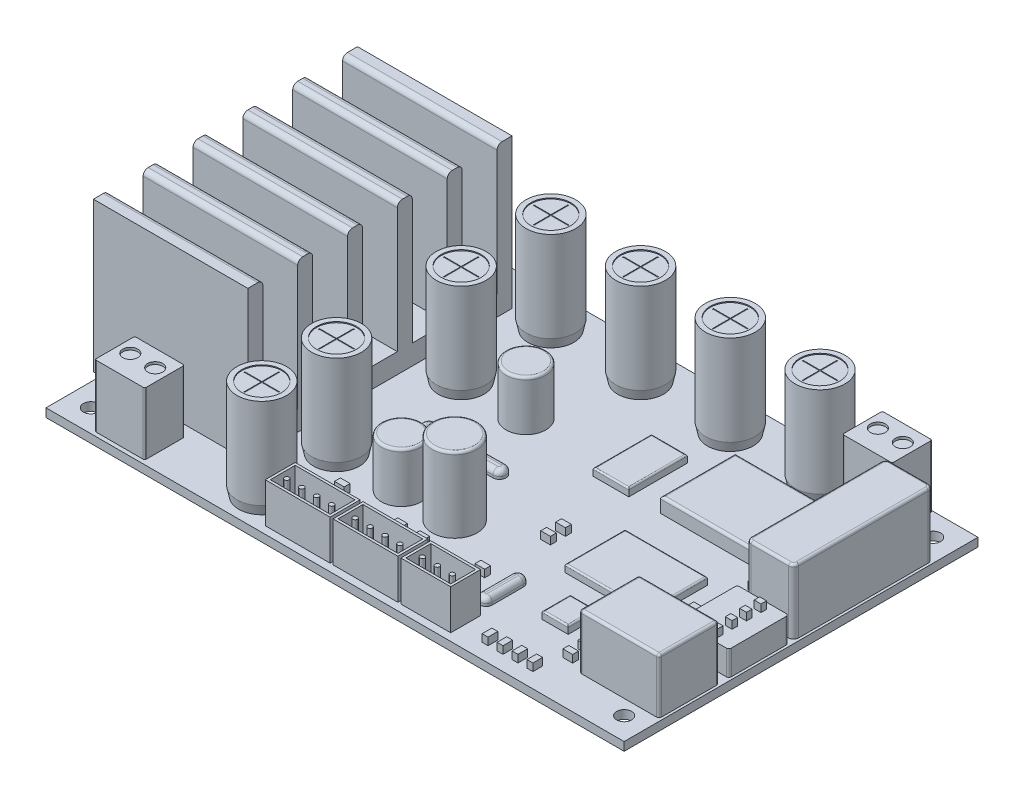
from build123d import *

# Parameters (mm, degrees)
SKETCH1_W               = 116
SKETCH1_H               = 71
SKETCH1_R               = 1.5
BOSS_EXTRUDE1_DEPTH     = 1.7
SKETCH2_R               = 5
BOSS_EXTRUDE2_DEPTH     = 20
SKETCH3_R               = 4
CUT_EXTRUDE1_DEPTH      = 0.2
SKETCH4_W               = 0.2
SKETCH4_H               = 3.4
SKETCH4_W_2             = 3.4
SKETCH4_H_2             = 0.2
CUT_EXTRUDE2_DEPTH      = 0.1
SKETCH5_R               = 5.6
SKETCH5_R_2             = 4.6
CUT_EXTRUDE_THIN1_DEPTH = 2
CUT_EXTRUDE_THIN1_DRAFT = 12
LPATTERN1_START         = 3.581851944
LPATTERN1_OUTLINE_R     = 5
LPATTERN1_DEPTH         = 17.818148056
LPATTERN1_START_2       = 1.7
LPATTERN1_2_OUTLINE_R   = 4
LPATTERN1_2_DEPTH       = 19.7
LPATTERN1_START_3       = 21.4
LPATTERN1_3_OUTLINE_R   = 5
LPATTERN1_3_OUTLINE_R_2 = 4
LPATTERN1_3_DEPTH       = 0.3
LPATTERN1_4_OUTLINE_R   = 4
LPATTERN1_4_DEPTH       = 0.1
BOSS_EXTRUDE3_DEPTH     = 12.5
SKETCH7_R               = 1.5
CUT_EXTRUDE3_DEPTH      = 0.5
LPATTERN2_COUNT         = 2
LPATTERN2_PITCH         = 88
LPATTERN2_COUNT_DIR2    = 2
LPATTERN2_PITCH_DIR2    = 62
SKETCH8_W               = 15
SKETCH8_H               = 35
BOSS_EXTRUDE4_DEPTH     = 2
SKETCH9_W               = 31
SKETCH9_H               = 53
BOSS_EXTRUDE5_DEPTH     = 30
CUT_EXTRUDE5_DEPTH      = 31
SKETCH11_R              = 4
BOSS_EXTRUDE6_DEPTH     = 10
FILLET1_R               = 0.5
SKETCH12_R              = 4.5
BOSS_EXTRUDE7_DEPTH     = 15
FILLET2_R               = 0.5
SKETCH13_W              = 13
SKETCH13_H              = 6
SKETCH13_W_2            = 10
BOSS_EXTRUDE8_DEPTH     = 8
SKETCH14_W              = 12
SKETCH14_H              = 5
SKETCH14_R              = 0.459808867
SKETCH14_W_2            = 9
CUT_EXTRUDE6_DEPTH      = 6
BOSS_EXTRUDE9_DEPTH     = 13
FILLET3_R               = 0.5
BOSS_EXTRUDE10_DEPTH    = 5
SKETCH17_W              = 1.363659291
SKETCH17_H              = 1.107973174
BOSS_EXTRUDE11_DEPTH    = 1.5
BOSS_EXTRUDE12_DEPTH    = 11
FILLET4_R               = 0.5
SKETCH19_W              = 20
SKETCH19_H              = 15
SKETCH19_W_2            = 3
SKETCH19_H_2            = 2
BOSS_EXTRUDE13_DEPTH    = 3
FILLET5_R               = 0.5
SKETCH20_W              = 7.169338187
SKETCH20_H              = 11.731644306
SKETCH20_W_2            = 16.511203098
SKETCH20_H_2            = 12.070508149
SKETCH20_W_3            = 5.214064136
SKETCH20_H_3            = 5.648569481
SKETCH20_W_4            = 1.946575624
SKETCH20_H_4            = 1.189529037
SKETCH20_W_5            = 1.189529037
SKETCH20_H_5            = 1.946575624
BOSS_EXTRUDE14_DEPTH    = 1.5
FILLET6_R               = 1
FILLET7_R               = 0.3


with BuildPart() as part:
    # Sketch1 → Boss-Extrude1 (new body)
    with BuildSketch(Plane(origin=(0, 0, 0), x_dir=(1, 0, 0), z_dir=(0, 1, 0))):
        Rectangle(SKETCH1_W, SKETCH1_H)
        with Locations(Location((53.5, 31, 0), (0, 0, 270))):
            Circle(SKETCH1_R, mode=Mode.SUBTRACT)
        with Locations(Location((-53.5, 31, 0), (0, 0, 90))):
            Circle(SKETCH1_R, mode=Mode.SUBTRACT)
        with Locations(Location((53.5, -31, 0), (0, 0, 90))):
            Circle(SKETCH1_R, mode=Mode.SUBTRACT)
        with Locations(Location((-53.5, -31, 0), (0, 0, 270))):
            Circle(SKETCH1_R, mode=Mode.SUBTRACT)
    extrude(amount=BOSS_EXTRUDE1_DEPTH)

    # Sketch2 → Boss-Extrude2 (add)
    with BuildSketch(Plane(origin=(0, 1.7, 0), x_dir=(1, 0, 0), z_dir=(0, 1, 0))):
        with Locations(Location((33, 28.8, 0), (0, 0, 90))):
            Circle(SKETCH2_R)
    extrude(amount=BOSS_EXTRUDE2_DEPTH)

    # Sketch3 → Cut-Extrude1 (cut)
    with BuildSketch(Plane(origin=(0, 21.7, 0), x_dir=(1, 0, 0), z_dir=(0, 1, 0))):
        with Locations(Location((33, 28.8, 0), (0, 0, 270))):
            Circle(SKETCH3_R)
    extrude(amount=-CUT_EXTRUDE1_DEPTH, mode=Mode.SUBTRACT)

    # Sketch4 → Cut-Extrude2 (cut)
    with BuildSketch(Plane(origin=(0, 21.5, 0), x_dir=(1, 0, 0), z_dir=(0, 1, 0))):
        with Locations((33, 30.6)):
            Rectangle(SKETCH4_W, SKETCH4_H)
        with Locations((34.8, 28.8)):
            Rectangle(SKETCH4_W_2, SKETCH4_H_2)
        with Locations((33, 28.8)):
            Rectangle(SKETCH4_W, SKETCH4_H_2)
        with Locations((31.2, 28.8)):
            Rectangle(SKETCH4_W_2, SKETCH4_H_2)
        with Locations((33, 27)):
            Rectangle(SKETCH4_W, SKETCH4_H)
    extrude(amount=-CUT_EXTRUDE2_DEPTH, mode=Mode.SUBTRACT)


with BuildPart() as cut_extrude_thin1_tool:
    # Sketch5 → Cut-Extrude-Thin1 (with draft: the straight prism first)
    with BuildSketch(Plane(origin=(0, 1.7, 0), x_dir=(1, 0, 0), z_dir=(0, 1, 0))):
        with Locations((33, 28.8)):
            Circle(SKETCH5_R)
        with Locations((33, 28.8)):
            Circle(SKETCH5_R_2, mode=Mode.SUBTRACT)
    extrude(amount=CUT_EXTRUDE_THIN1_DEPTH)
    # Cut-Extrude-Thin1: the draft: its side faces are tilted about the plane it starts from
    cut_extrude_thin1_sides = [cut_extrude_thin1_tool.faces().sort_by_distance(p)[0] for p in [
        (27.4, 2.7, -28.8),
        (28.4, 2.7, -28.8),
    ]]
    draft(cut_extrude_thin1_sides, Plane(origin=(0, 1.7, 0), x_dir=(1, 0, 0), z_dir=(0, 1, 0)), CUT_EXTRUDE_THIN1_DRAFT)


with BuildPart() as part_1:
    add(part.part)

    # Cut-Extrude-Thin1: cut by cut_extrude_thin1_tool
    add(cut_extrude_thin1_tool.part, mode=Mode.SUBTRACT)



with BuildPart() as body_2:
    # LPattern1: read off the stored shape, not the designer's step
    # LPattern1 outline → LPattern1 (new body)
    with BuildSketch(Plane(origin=(0, 0, 0), x_dir=(1, 0, 0), z_dir=(0, 1, 0)).offset(LPATTERN1_START)):
        with Locations((15, 28.8)):
            Circle(LPATTERN1_OUTLINE_R)
        with Locations((-21, 28.8)):
            Circle(LPATTERN1_OUTLINE_R)
        with Locations((-3, 28.8)):
            Circle(LPATTERN1_OUTLINE_R)
        with Locations((-21, -29.2)):
            Circle(LPATTERN1_OUTLINE_R)
        with Locations((-21, -14.2)):
            Circle(LPATTERN1_OUTLINE_R)
        with Locations((-21, 10.8)):
            Circle(LPATTERN1_OUTLINE_R)
    extrude(amount=LPATTERN1_DEPTH)


with BuildPart() as part_2:
    add(part_1.part)

    add(body_2.part)  # LPattern1 2 merges body 2
    # LPattern1 2 outline → LPattern1 2 (add)
    with BuildSketch(Plane(origin=(0, 0, 0), x_dir=(1, 0, 0), z_dir=(0, 1, 0)).offset(LPATTERN1_START_2)):
        with Locations((15, 28.8)):
            Circle(LPATTERN1_2_OUTLINE_R)
        with Locations((-21, 28.8)):
            Circle(LPATTERN1_2_OUTLINE_R)
        with Locations((-3, 28.8)):
            Circle(LPATTERN1_2_OUTLINE_R)
        with Locations((-21, -29.2)):
            Circle(LPATTERN1_2_OUTLINE_R)
        with Locations((-21, -14.2)):
            Circle(LPATTERN1_2_OUTLINE_R)
        with Locations((-21, 10.8)):
            Circle(LPATTERN1_2_OUTLINE_R)
    extrude(amount=LPATTERN1_2_DEPTH)

    # LPattern1 3 outline → LPattern1 3 (add)
    # profile 1 of 6: a face of its own
    with BuildSketch(Plane(origin=(0, 0, 0), x_dir=(1, 0, 0), z_dir=(0, 1, 0)).offset(LPATTERN1_START_3)):
        with Locations((15, 28.8)):
            Circle(LPATTERN1_3_OUTLINE_R)
        with Locations((15, 28.8)):
            Circle(LPATTERN1_3_OUTLINE_R_2, mode=Mode.SUBTRACT)
    # profile 2 of 6: a face of its own
    with BuildSketch(Plane(origin=(0, 0, 0), x_dir=(1, 0, 0), z_dir=(0, 1, 0)).offset(LPATTERN1_START_3)):
        with Locations((-21, -29.2)):
            Circle(LPATTERN1_3_OUTLINE_R)
        with Locations((-21, -29.2)):
            Circle(LPATTERN1_3_OUTLINE_R_2, mode=Mode.SUBTRACT)
    # profile 3 of 6: a face of its own
    with BuildSketch(Plane(origin=(0, 0, 0), x_dir=(1, 0, 0), z_dir=(0, 1, 0)).offset(LPATTERN1_START_3)):
        with Locations((-21, -14.2)):
            Circle(LPATTERN1_3_OUTLINE_R)
        with Locations((-21, -14.2)):
            Circle(LPATTERN1_3_OUTLINE_R_2, mode=Mode.SUBTRACT)
    # profile 4 of 6: a face of its own
    with BuildSketch(Plane(origin=(0, 0, 0), x_dir=(1, 0, 0), z_dir=(0, 1, 0)).offset(LPATTERN1_START_3)):
        with Locations((-21, 10.8)):
            Circle(LPATTERN1_3_OUTLINE_R)
        with Locations((-21, 10.8)):
            Circle(LPATTERN1_3_OUTLINE_R_2, mode=Mode.SUBTRACT)
    # profile 5 of 6: a face of its own
    with BuildSketch(Plane(origin=(0, 0, 0), x_dir=(1, 0, 0), z_dir=(0, 1, 0)).offset(LPATTERN1_START_3)):
        with Locations((-21, 28.8)):
            Circle(LPATTERN1_3_OUTLINE_R)
        with Locations((-21, 28.8)):
            Circle(LPATTERN1_3_OUTLINE_R_2, mode=Mode.SUBTRACT)
    # profile 6 of 6: a face of its own
    with BuildSketch(Plane(origin=(0, 0, 0), x_dir=(1, 0, 0), z_dir=(0, 1, 0)).offset(LPATTERN1_START_3)):
        with Locations((-3, 28.8)):
            Circle(LPATTERN1_3_OUTLINE_R)
        with Locations((-3, 28.8)):
            Circle(LPATTERN1_3_OUTLINE_R_2, mode=Mode.SUBTRACT)
    extrude(amount=LPATTERN1_3_DEPTH)

    # LPattern1 4 outline → LPattern1 4 (add)
    # profile 1 of 6: a face of its own
    with BuildSketch(Plane(origin=(0, 0, 0), x_dir=(1, 0, 0), z_dir=(0, 1, 0)).offset(LPATTERN1_START_3)):
        with Locations((15, 28.8)):
            Circle(LPATTERN1_4_OUTLINE_R)
        Polygon((14.9, 28.9), (14.9, 32.3), (15.1, 32.3), (15.1, 28.9), (18.5, 28.9), (18.5, 28.7), (15.1, 28.7), (15.1, 25.3), (14.9, 25.3), (14.9, 28.7), (11.5, 28.7), (11.5, 28.9), align=None, mode=Mode.SUBTRACT)
    # profile 2 of 6: a face of its own
    with BuildSketch(Plane(origin=(0, 0, 0), x_dir=(1, 0, 0), z_dir=(0, 1, 0)).offset(LPATTERN1_START_3)):
        with Locations((-21, -29.2)):
            Circle(LPATTERN1_4_OUTLINE_R)
        Polygon((-21.1, -29.3), (-24.5, -29.3), (-24.5, -29.1), (-21.1, -29.1), (-21.1, -25.7), (-20.9, -25.7), (-20.9, -29.1), (-17.5, -29.1), (-17.5, -29.3), (-20.9, -29.3), (-20.9, -32.7), (-21.1, -32.7), align=None, mode=Mode.SUBTRACT)
    # profile 3 of 6: a face of its own
    with BuildSketch(Plane(origin=(0, 0, 0), x_dir=(1, 0, 0), z_dir=(0, 1, 0)).offset(LPATTERN1_START_3)):
        with Locations((-21, -14.2)):
            Circle(LPATTERN1_4_OUTLINE_R)
        Polygon((-21.1, -14.3), (-24.5, -14.3), (-24.5, -14.1), (-21.1, -14.1), (-21.1, -10.7), (-20.9, -10.7), (-20.9, -14.1), (-17.5, -14.1), (-17.5, -14.3), (-20.9, -14.3), (-20.9, -17.7), (-21.1, -17.7), align=None, mode=Mode.SUBTRACT)
    # profile 4 of 6: a face of its own
    with BuildSketch(Plane(origin=(0, 0, 0), x_dir=(1, 0, 0), z_dir=(0, 1, 0)).offset(LPATTERN1_START_3)):
        with Locations((-21, 10.8)):
            Circle(LPATTERN1_4_OUTLINE_R)
        Polygon((-21.1, 10.7), (-24.5, 10.7), (-24.5, 10.9), (-21.1, 10.9), (-21.1, 14.3), (-20.9, 14.3), (-20.9, 10.9), (-17.5, 10.9), (-17.5, 10.7), (-20.9, 10.7), (-20.9, 7.3), (-21.1, 7.3), align=None, mode=Mode.SUBTRACT)
    # profile 5 of 6: a face of its own
    with BuildSketch(Plane(origin=(0, 0, 0), x_dir=(1, 0, 0), z_dir=(0, 1, 0)).offset(LPATTERN1_START_3)):
        with Locations((-21, 28.8)):
            Circle(LPATTERN1_4_OUTLINE_R)
        Polygon((-21.1, 28.9), (-21.1, 32.3), (-20.9, 32.3), (-20.9, 28.9), (-17.5, 28.9), (-17.5, 28.7), (-20.9, 28.7), (-20.9, 25.3), (-21.1, 25.3), (-21.1, 28.7), (-24.5, 28.7), (-24.5, 28.9), align=None, mode=Mode.SUBTRACT)
    # profile 6 of 6: a face of its own
    with BuildSketch(Plane(origin=(0, 0, 0), x_dir=(1, 0, 0), z_dir=(0, 1, 0)).offset(LPATTERN1_START_3)):
        with Locations((-3, 28.8)):
            Circle(LPATTERN1_4_OUTLINE_R)
        Polygon((-3.1, 28.9), (-3.1, 32.3), (-2.9, 32.3), (-2.9, 28.9), (0.5, 28.9), (0.5, 28.7), (-2.9, 28.7), (-2.9, 25.3), (-3.1, 25.3), (-3.1, 28.7), (-6.5, 28.7), (-6.5, 28.9), align=None, mode=Mode.SUBTRACT)
    extrude(amount=LPATTERN1_4_DEPTH)

    # LPattern1 5: loft between two sections, ruled curve by curve
    lpattern1_5_from = [
        Edge.make_three_point_arc((15, 1.7, -24.2), (19.6, 1.7, -28.8), (15, 1.7, -33.4)),
        Edge.make_three_point_arc((15, 1.7, -33.4), (10.4, 1.7, -28.8), (15, 1.7, -24.2)),
    ]
    lpattern1_5_to = [
        Edge.make_three_point_arc((15, 3.581852044, -23.8), (20, 3.581852044, -28.8), (15, 3.581852044, -33.8)),
        Edge.make_three_point_arc((15, 3.581852044, -33.8), (10, 3.581852044, -28.8), (15, 3.581852044, -23.8)),
    ]
    lpattern1_5 = Solid(Shell([*[Face.make_surface_from_curves(lpattern1_5_from[k], lpattern1_5_to[k]) for k in range(2)], Face(Wire(lpattern1_5_from)), Face(Wire(lpattern1_5_to))]))
    add(lpattern1_5)

    # LPattern1 6: loft between two sections, ruled curve by curve
    lpattern1_6_from = [
        Edge.make_three_point_arc((-21, 1.7, 33.8), (-16.4, 1.7, 29.2), (-21, 1.7, 24.6)),
        Edge.make_three_point_arc((-21, 1.7, 24.6), (-25.6, 1.7, 29.2), (-21, 1.7, 33.8)),
    ]
    lpattern1_6_to = [
        Edge.make_three_point_arc((-21, 3.581852044, 34.2), (-16, 3.581852044, 29.2), (-21, 3.581852044, 24.2)),
        Edge.make_three_point_arc((-21, 3.581852044, 24.2), (-26, 3.581852044, 29.2), (-21, 3.581852044, 34.2)),
    ]
    lpattern1_6 = Solid(Shell([*[Face.make_surface_from_curves(lpattern1_6_from[k], lpattern1_6_to[k]) for k in range(2)], Face(Wire(lpattern1_6_from)), Face(Wire(lpattern1_6_to))]))
    add(lpattern1_6)

    # LPattern1 7: loft between two sections, ruled curve by curve
    lpattern1_7_from = [
        Edge.make_three_point_arc((-21, 1.7, 18.8), (-16.4, 1.7, 14.2), (-21, 1.7, 9.6)),
        Edge.make_three_point_arc((-21, 1.7, 9.6), (-25.6, 1.7, 14.2), (-21, 1.7, 18.8)),
    ]
    lpattern1_7_to = [
        Edge.make_three_point_arc((-21, 3.581852044, 19.2), (-16, 3.581852044, 14.2), (-21, 3.581852044, 9.2)),
        Edge.make_three_point_arc((-21, 3.581852044, 9.2), (-26, 3.581852044, 14.2), (-21, 3.581852044, 19.2)),
    ]
    lpattern1_7 = Solid(Shell([*[Face.make_surface_from_curves(lpattern1_7_from[k], lpattern1_7_to[k]) for k in range(2)], Face(Wire(lpattern1_7_from)), Face(Wire(lpattern1_7_to))]))
    add(lpattern1_7)

    # LPattern1 8: loft between two sections, ruled curve by curve
    lpattern1_8_from = [
        Edge.make_three_point_arc((-21, 1.7, -6.2), (-16.4, 1.7, -10.8), (-21, 1.7, -15.4)),
        Edge.make_three_point_arc((-21, 1.7, -15.4), (-25.6, 1.7, -10.8), (-21, 1.7, -6.2)),
    ]
    lpattern1_8_to = [
        Edge.make_three_point_arc((-21, 3.581852044, -5.8), (-16, 3.581852044, -10.8), (-21, 3.581852044, -15.8)),
        Edge.make_three_point_arc((-21, 3.581852044, -15.8), (-26, 3.581852044, -10.8), (-21, 3.581852044, -5.8)),
    ]
    lpattern1_8 = Solid(Shell([*[Face.make_surface_from_curves(lpattern1_8_from[k], lpattern1_8_to[k]) for k in range(2)], Face(Wire(lpattern1_8_from)), Face(Wire(lpattern1_8_to))]))
    add(lpattern1_8)

    # LPattern1 9: loft between two sections, ruled curve by curve
    lpattern1_9_from = [
        Edge.make_three_point_arc((-21, 1.7, -24.2), (-16.4, 1.7, -28.8), (-21, 1.7, -33.4)),
        Edge.make_three_point_arc((-21, 1.7, -33.4), (-25.6, 1.7, -28.8), (-21, 1.7, -24.2)),
    ]
    lpattern1_9_to = [
        Edge.make_three_point_arc((-21, 3.581852044, -23.8), (-16, 3.581852044, -28.8), (-21, 3.581852044, -33.8)),
        Edge.make_three_point_arc((-21, 3.581852044, -33.8), (-26, 3.581852044, -28.8), (-21, 3.581852044, -23.8)),
    ]
    lpattern1_9 = Solid(Shell([*[Face.make_surface_from_curves(lpattern1_9_from[k], lpattern1_9_to[k]) for k in range(2)], Face(Wire(lpattern1_9_from)), Face(Wire(lpattern1_9_to))]))
    add(lpattern1_9)

    # LPattern1 10: loft between two sections, ruled curve by curve
    lpattern1_10_from = [
        Edge.make_three_point_arc((-3, 1.7, -24.2), (1.6, 1.7, -28.8), (-3, 1.7, -33.4)),
        Edge.make_three_point_arc((-3, 1.7, -33.4), (-7.6, 1.7, -28.8), (-3, 1.7, -24.2)),
    ]
    lpattern1_10_to = [
        Edge.make_three_point_arc((-3, 3.581852044, -23.8), (2, 3.581852044, -28.8), (-3, 3.581852044, -33.8)),
        Edge.make_three_point_arc((-3, 3.581852044, -33.8), (-8, 3.581852044, -28.8), (-3, 3.581852044, -23.8)),
    ]
    lpattern1_10 = Solid(Shell([*[Face.make_surface_from_curves(lpattern1_10_from[k], lpattern1_10_to[k]) for k in range(2)], Face(Wire(lpattern1_10_from)), Face(Wire(lpattern1_10_to))]))
    add(lpattern1_10)

    # Sketch6 → Boss-Extrude3 (add)
    with BuildSketch(Plane(origin=(0, 1.7, 0), x_dir=(1, 0, 0), z_dir=(0, 1, 0))):
        with BuildLine():
            Line((39.3, 27.3), (48.7, 27.3))
            ThreePointArc((48.7, 27.3), (48.912132034, 27.387867966), (49, 27.6))
            Line((49, 27.6), (49, 35))
            ThreePointArc((49, 35), (48.912132034, 35.212132034), (48.7, 35.3))
            Line((48.7, 35.3), (39.3, 35.3))
            ThreePointArc((39.3, 35.3), (39.087867966, 35.212132034), (39, 35))
            Line((39, 35), (39, 27.6))
            ThreePointArc((39, 27.6), (39.087867966, 27.387867966), (39.3, 27.3))
        make_face()
    boss_extrude3 = extrude(amount=BOSS_EXTRUDE3_DEPTH)

    # Sketch7 → Cut-Extrude3 (cut)
    with BuildSketch(Plane(origin=(0, 14.2, 0), x_dir=(1, 0, 0), z_dir=(0, 1, 0))):
        with Locations(Location((41.5, 31.913386137, 0), (0, 0, 270))):
            Circle(SKETCH7_R)
        with Locations(Location((46.5, 31.913386137, 0), (0, 0, 270))):
            Circle(SKETCH7_R)
    cut_extrude3 = extrude(amount=-CUT_EXTRUDE3_DEPTH, mode=Mode.SUBTRACT)

    # LPattern2: Boss-Extrude3, Cut-Extrude3 2 × 2, 1 skipped
    with Locations(*[(-i * LPATTERN2_PITCH, 0, j * LPATTERN2_PITCH_DIR2) for i in range(LPATTERN2_COUNT) for j in range(LPATTERN2_COUNT_DIR2) if (i, j) not in ((0, 0), (0, 1))]):
        add(boss_extrude3)
        add(cut_extrude3, mode=Mode.SUBTRACT)

    # Sketch8 → Boss-Extrude4 (add)
    with BuildSketch(Plane(origin=(0, 1.7, 0), x_dir=(1, 0, 0), z_dir=(0, 1, 0))):
        with Locations((-45, 0)):
            Rectangle(SKETCH8_W, SKETCH8_H)
    extrude(amount=BOSS_EXTRUDE4_DEPTH)

    # Sketch9 → Boss-Extrude5 (add)
    with BuildSketch(Plane(origin=(0, 3.7, 0), x_dir=(1, 0, 0), z_dir=(0, 1, 0))):
        with Locations((-42, 0)):
            Rectangle(SKETCH9_W, SKETCH9_H)
    extrude(amount=BOSS_EXTRUDE5_DEPTH)

    # Sketch10 → Cut-Extrude5 (cut)
    with BuildSketch(Plane.ZY.offset(57.5)):
        Polygon((25.5, 33.7), (26.5, 33.7), (26.5, 38.379287755), (-26.5, 38.379287755), (-26.5, 33.7), (-25.5, 33.7), (-24.5, 33.7), (-15.5, 33.7), (-14.5, 33.7), (-5.5, 33.7), (-4.5, 33.7), (4.5, 33.7), (5.5, 33.7), (14.5, 33.7), (15.5, 33.7), (24.5, 33.7), align=None)
        with BuildLine():
            Line((16.5, 7.7), (23.5, 7.7))
            Line((23.5, 7.7), (23.5, 32.7))
            ThreePointArc((23.5, 32.7), (23.792893219, 33.407106781), (24.5, 33.7))
            Line((24.5, 33.7), (15.5, 33.7))
            ThreePointArc((15.5, 33.7), (16.207106781, 33.407106781), (16.5, 32.7))
            Line((16.5, 32.7), (16.5, 7.7))
        make_face()
        with BuildLine():
            Line((6.5, 7.7), (13.5, 7.7))
            Line((13.5, 7.7), (13.5, 32.7))
            ThreePointArc((13.5, 32.7), (13.792893219, 33.407106781), (14.5, 33.7))
            Line((14.5, 33.7), (5.5, 33.7))
            ThreePointArc((5.5, 33.7), (6.207106781, 33.407106781), (6.5, 32.7))
            Line((6.5, 32.7), (6.5, 7.7))
        make_face()
        with BuildLine():
            Line((-3.5, 7.7), (3.5, 7.7))
            Line((3.5, 7.7), (3.5, 32.7))
            ThreePointArc((3.5, 32.7), (3.792893219, 33.407106781), (4.5, 33.7))
            Line((4.5, 33.7), (-4.5, 33.7))
            ThreePointArc((-4.5, 33.7), (-3.792893219, 33.407106781), (-3.5, 32.7))
            Line((-3.5, 32.7), (-3.5, 7.7))
        make_face()
        with BuildLine():
            Line((-13.5, 7.7), (-6.5, 7.7))
            Line((-6.5, 7.7), (-6.5, 32.7))
            ThreePointArc((-6.5, 32.7), (-6.207106781, 33.407106781), (-5.5, 33.7))
            Line((-5.5, 33.7), (-14.5, 33.7))
            ThreePointArc((-14.5, 33.7), (-13.792893219, 33.407106781), (-13.5, 32.7))
            Line((-13.5, 32.7), (-13.5, 7.7))
        make_face()
        with BuildLine():
            Line((-15.5, 33.7), (-24.5, 33.7))
            ThreePointArc((-24.5, 33.7), (-23.792893219, 33.407106781), (-23.5, 32.7))
            Line((-23.5, 32.7), (-23.5, 7.7))
            Line((-23.5, 7.7), (-16.5, 7.7))
            Line((-16.5, 7.7), (-16.5, 32.7))
            ThreePointArc((-16.5, 32.7), (-16.207106781, 33.407106781), (-15.5, 33.7))
        make_face()
    extrude(amount=-CUT_EXTRUDE5_DEPTH, mode=Mode.SUBTRACT)

    # Sketch11 → Boss-Extrude6 (add)
    with BuildSketch(Plane(origin=(0, 1.7, 0), x_dir=(1, 0, 0), z_dir=(0, 1, 0))):
        with Locations(Location((-8, 10.8, 0), (0, 0, 90))):
            Circle(SKETCH11_R)
        with Locations(Location((-8, -14.2, 0), (0, 0, 90))):
            Circle(SKETCH11_R)
    extrude(amount=BOSS_EXTRUDE6_DEPTH)

    # Fillet1
    fillet1_edges = [part_2.edges().sort_by_distance(p)[0] for p in [
        (-8, 11.7, -6.8),
        (-8, 11.7, 18.2),
    ]]
    fillet(fillet1_edges, radius=FILLET1_R)

    # Sketch12 → Boss-Extrude7 (add)
    with BuildSketch(Plane(origin=(0, 1.7, 0), x_dir=(1, 0, 0), z_dir=(0, 1, 0))):
        with Locations(Location((2.5, -14, 0), (0, 0, 90))):
            Circle(SKETCH12_R)
    extrude(amount=BOSS_EXTRUDE7_DEPTH)

    # Fillet2
    fillet2_edges = [part_2.edges().sort_by_distance(p)[0] for p in [
        (2.5, 16.7, 18.5),
    ]]
    fillet(fillet2_edges, radius=FILLET2_R)

    # Sketch13 → Boss-Extrude8 (add)
    with BuildSketch(Plane(origin=(0, 1.7, 0), x_dir=(1, 0, 0), z_dir=(0, 1, 0))):
        with Locations((-9, -31)):
            Rectangle(SKETCH13_W, SKETCH13_H)
        with Locations((4.6, -31)):
            Rectangle(SKETCH13_W, SKETCH13_H)
        with Locations((16.7, -31)):
            Rectangle(SKETCH13_W_2, SKETCH13_H)
    extrude(amount=BOSS_EXTRUDE8_DEPTH)

    # Sketch14 → Cut-Extrude6 (cut)
    # profile 1 of 3: a face of its own
    with BuildSketch(Plane(origin=(0, 9.7, 0), x_dir=(1, 0, 0), z_dir=(0, 1, 0))):
        with Locations((-9, -31)):
            Rectangle(SKETCH14_W, SKETCH14_H)
        with Locations(Location((-13.553216535, -31.632143805, 0), (0, 0, 270))):
            Circle(SKETCH14_R, mode=Mode.SUBTRACT)
        with Locations(Location((-10.553216535, -31.632143805, 0), (0, 0, 270))):
            Circle(SKETCH14_R, mode=Mode.SUBTRACT)
        with Locations(Location((-7.553216535, -31.632143805, 0), (0, 0, 270))):
            Circle(SKETCH14_R, mode=Mode.SUBTRACT)
        with Locations(Location((-4.553216535, -31.632143805, 0), (0, 0, 270))):
            Circle(SKETCH14_R, mode=Mode.SUBTRACT)
    # profile 2 of 3: a face of its own
    with BuildSketch(Plane(origin=(0, 9.7, 0), x_dir=(1, 0, 0), z_dir=(0, 1, 0))):
        with Locations((4.6, -31)):
            Rectangle(SKETCH14_W, SKETCH14_H)
        with Locations(Location((0.153216535, -31.632143805, 0), (0, 0, 270))):
            Circle(SKETCH14_R, mode=Mode.SUBTRACT)
        with Locations(Location((3.153216535, -31.632143805, 0), (0, 0, 270))):
            Circle(SKETCH14_R, mode=Mode.SUBTRACT)
        with Locations(Location((6.153216535, -31.632143805, 0), (0, 0, 270))):
            Circle(SKETCH14_R, mode=Mode.SUBTRACT)
        with Locations(Location((9.153216535, -31.632143805, 0), (0, 0, 270))):
            Circle(SKETCH14_R, mode=Mode.SUBTRACT)
    # profile 3 of 3: a face of its own
    with BuildSketch(Plane(origin=(0, 9.7, 0), x_dir=(1, 0, 0), z_dir=(0, 1, 0))):
        with Locations((16.7, -31)):
            Rectangle(SKETCH14_W_2, SKETCH14_H)
        with Locations(Location((13.646783465, -31.632143805, 0), (0, 0, 270))):
            Circle(SKETCH14_R, mode=Mode.SUBTRACT)
        with Locations(Location((16.646783465, -31.632143805, 0), (0, 0, 270))):
            Circle(SKETCH14_R, mode=Mode.SUBTRACT)
        with Locations(Location((19.646783465, -31.632143805, 0), (0, 0, 270))):
            Circle(SKETCH14_R, mode=Mode.SUBTRACT)
    extrude(amount=-CUT_EXTRUDE6_DEPTH, mode=Mode.SUBTRACT)

    # Sketch15 → Boss-Extrude9 (add)
    with BuildSketch(Plane(origin=(0, 1.7, 0), x_dir=(1, 0, 0), z_dir=(0, 1, 0))):
        with BuildLine():
            Line((56.5, 27), (49, 27))
            ThreePointArc((49, 27), (48.292893219, 26.707106781), (48, 26))
            Line((48, 26), (48, 0))
            ThreePointArc((48, 0), (48.292893219, -0.707106781), (49, -1))
            Line((49, -1), (56.5, -1))
            ThreePointArc((56.5, -1), (57.207106781, -0.707106781), (57.5, 0))
            Line((57.5, 0), (57.5, 26))
            ThreePointArc((57.5, 26), (57.207106781, 26.707106781), (56.5, 27))
        make_face()
    extrude(amount=BOSS_EXTRUDE9_DEPTH)

    # Fillet3
    fillet3_edges = [part_2.edges().sort_by_distance(p)[0] for p in [
        (57.207106781, 14.7, -26.707106781),
        (52.75, 14.7, -27),
        (48.292893219, 14.7, -26.707106781),
        (48, 14.7, -13),
        (48.292893219, 14.7, 0.707106781),
        (52.75, 14.7, 1),
        (57.207106781, 14.7, 0.707106781),
        (57.5, 14.7, -13),
    ]]
    fillet(fillet3_edges, radius=FILLET3_R)

    # Sketch16 → Boss-Extrude10 (add)
    with BuildSketch(Plane(origin=(0, 1.7, 0), x_dir=(1, 0, 0), z_dir=(0, 1, 0))):
        with BuildLine():
            Line((47.7, -14), (57, -14))
            ThreePointArc((57, -14), (57.353553391, -13.853553391), (57.5, -13.5))
            Line((57.5, -13.5), (57.5, -2.5))
            ThreePointArc((57.5, -2.5), (57.353553391, -2.146446609), (57, -2))
            Line((57, -2), (47.7, -2))
            ThreePointArc((47.7, -2), (47.346446609, -2.146446609), (47.2, -2.5))
            Line((47.2, -2.5), (47.2, -13.5))
            ThreePointArc((47.2, -13.5), (47.346446609, -13.853553391), (47.7, -14))
        make_face()
    extrude(amount=BOSS_EXTRUDE10_DEPTH)

    # Sketch17 → Boss-Extrude11 (add)
    with BuildSketch(Plane(origin=(0, 6.7, 0), x_dir=(1, 0, 0), z_dir=(0, 1, 0))):
        with Locations((53.632306445, -6.707784089)):
            Rectangle(SKETCH17_W, SKETCH17_H)
        with Locations((53.632306445, -3.807784089)):
            Rectangle(SKETCH17_W, SKETCH17_H)
        with Locations((53.632306445, -9.607784089)):
            Rectangle(SKETCH17_W, SKETCH17_H)
        with Locations((53.632306445, -12.507784089)):
            Rectangle(SKETCH17_W, SKETCH17_H)
    extrude(amount=BOSS_EXTRUDE11_DEPTH)

    # Sketch18 → Boss-Extrude12 (add)
    with BuildSketch(Plane(origin=(0, 1.7, 0), x_dir=(1, 0, 0), z_dir=(0, 1, 0))):
        with BuildLine():
            Line((42, -16), (57, -16))
            ThreePointArc((57, -16), (57.353553391, -16.146446609), (57.5, -16.5))
            Line((57.5, -16.5), (57.5, -27.5))
            ThreePointArc((57.5, -27.5), (57.353553391, -27.853553391), (57, -28))
            Line((57, -28), (42, -28))
            ThreePointArc((42, -28), (41.646446609, -27.853553391), (41.5, -27.5))
            Line((41.5, -27.5), (41.5, -16.5))
            ThreePointArc((41.5, -16.5), (41.646446609, -16.146446609), (42, -16))
        make_face()
    extrude(amount=BOSS_EXTRUDE12_DEPTH)

    # Fillet4
    fillet4_edges = [part_2.edges().sort_by_distance(p)[0] for p in [
        (41.646446609, 12.7, 27.853553391),
        (49.5, 12.7, 28),
        (57.353553391, 12.7, 27.853553391),
        (57.5, 12.7, 22),
        (57.353553391, 12.7, 16.146446609),
        (49.5, 12.7, 16),
        (41.646446609, 12.7, 16.146446609),
        (41.5, 12.7, 22),
    ]]
    fillet(fillet4_edges, radius=FILLET4_R)

    # Sketch19 → Boss-Extrude13 (add)
    with BuildSketch(Plane(origin=(0, 1.7, 0), x_dir=(1, 0, 0), z_dir=(0, 1, 0))):
        with Locations((32, 15.3)):
            Rectangle(SKETCH19_W, SKETCH19_H)
        with Locations((43.5, 18.8)):
            Rectangle(SKETCH19_W_2, SKETCH19_H_2)
        with Locations((43.5, 14.8)):
            Rectangle(SKETCH19_W_2, SKETCH19_H_2)
        with Locations((43.5, 10.8)):
            Rectangle(SKETCH19_W_2, SKETCH19_H_2)
    extrude(amount=BOSS_EXTRUDE13_DEPTH)

    # Fillet5
    fillet5_edges = [part_2.edges().sort_by_distance(p)[0] for p in [
        (45, 4.7, -10.8),
        (43.5, 4.7, -11.8),
        (45, 4.7, -14.8),
        (43.5, 4.7, -15.8),
        (45, 4.7, -18.8),
        (43.5, 4.7, -19.8),
        (32, 4.7, -22.8),
        (22, 4.7, -15.3),
        (32, 4.7, -7.8),
        (42, 4.7, -8.8),
        (43.5, 4.7, -9.8),
        (42, 4.7, -12.8),
        (43.5, 4.7, -13.8),
        (42, 4.7, -16.8),
        (43.5, 4.7, -17.8),
        (42, 4.7, -21.3),
    ]]
    fillet(fillet5_edges, radius=FILLET5_R)

    # Sketch20 → Boss-Extrude14 (add)
    with BuildSketch(Plane(origin=(0, 1.7, 0), x_dir=(1, 0, 0), z_dir=(0, 1, 0))):
        with Locations((12.369238112, 13.348054515)):
            Rectangle(SKETCH20_W, SKETCH20_H)
        with Locations((30.944341598, -6.035254075)):
            Rectangle(SKETCH20_W_2, SKETCH20_H_2)
        with Locations((31.16159427, -19.674351681)):
            Rectangle(SKETCH20_W_3, SKETCH20_H_3)
        with BuildLine():
            Line((18.640363835, -25.030085692), (18.640363835, -18.764608793))
            ThreePointArc((18.640363835, -18.764608793), (19.842645549, -17.562327079), (21.044927263, -18.764608793))
            Line((21.044927263, -18.764608793), (21.044927263, -25.030085692))
            ThreePointArc((21.044927263, -25.030085692), (19.842645549, -26.232367406), (18.640363835, -25.030085692))
        make_face()
        with Locations((38.226655335, -20.44483146)):
            Rectangle(SKETCH20_W_4, SKETCH20_H_4)
        with Locations((38.226655335, -17.44483146)):
            Rectangle(SKETCH20_W_4, SKETCH20_H_4)
        with Locations((38.226655335, -23.44483146)):
            Rectangle(SKETCH20_W_4, SKETCH20_H_4)
        with Locations((38.226655335, -26.44483146)):
            Rectangle(SKETCH20_W_4, SKETCH20_H_4)
        with Locations((36.098689028, -31.524145857)):
            Rectangle(SKETCH20_W_5, SKETCH20_H_5)
        with Locations((33.098689028, -31.524145857)):
            Rectangle(SKETCH20_W_5, SKETCH20_H_5)
        with Locations((30.098689028, -31.524145857)):
            Rectangle(SKETCH20_W_5, SKETCH20_H_5)
        with Locations((27.098689028, -31.524145857)):
            Rectangle(SKETCH20_W_5, SKETCH20_H_5)
        with Locations((43.183050234, -9.331962306)):
            Rectangle(SKETCH20_W_4, SKETCH20_H_4)
        with Locations((43.183050234, -6.331962306)):
            Rectangle(SKETCH20_W_4, SKETCH20_H_4)
        with Locations((43.183050234, -12.331962306)):
            Rectangle(SKETCH20_W_4, SKETCH20_H_4)
        with Locations((45.028865791, 3.887467844)):
            Rectangle(SKETCH20_W_4, SKETCH20_H_4)
        with Locations((45.028865791, 6.887467844)):
            Rectangle(SKETCH20_W_4, SKETCH20_H_4)
        with Locations((15.469987785, -8.142433269)):
            Rectangle(SKETCH20_W_4, SKETCH20_H_4)
        with Locations((15.469987785, -5.142433269)):
            Rectangle(SKETCH20_W_4, SKETCH20_H_4)
        with Locations((14.585267449, -23.44483146)):
            Rectangle(SKETCH20_W_4, SKETCH20_H_4)
        with Locations((14.585267449, -20.44483146)):
            Rectangle(SKETCH20_W_4, SKETCH20_H_4)
        with Locations((3.346042181, -24.435321174)):
            Rectangle(SKETCH20_W_4, SKETCH20_H_4)
        with Locations((3.346042181, -21.435321174)):
            Rectangle(SKETCH20_W_4, SKETCH20_H_4)
        with Locations((-1.110891977, -24.435321174)):
            Rectangle(SKETCH20_W_4, SKETCH20_H_4)
        with Locations((-1.110891977, -21.435321174)):
            Rectangle(SKETCH20_W_4, SKETCH20_H_4)
        with Locations((-13.80346534, -23.245792137)):
            Rectangle(SKETCH20_W_4, SKETCH20_H_4)
        with Locations((-13.80346534, -20.245792137)):
            Rectangle(SKETCH20_W_4, SKETCH20_H_4)
        with BuildLine():
            Line((-0.966692234, -2.840702212), (-5.954198867, -2.89371096))
            ThreePointArc((-5.954198867, -2.89371096), (-7.279272185, -1.596507997), (-5.982069222, -0.271434679))
            Line((-5.982069222, -0.271434679), (-0.99456259, -0.218425931))
            ThreePointArc((-0.99456259, -0.218425931), (0.330510728, -1.515628893), (-0.966692234, -2.840702212))
        make_face()
        with BuildLine():
            Line((-10.322489034, -2.609073438), (-15.309995666, -2.662082186))
            ThreePointArc((-15.309995666, -2.662082186), (-16.635068984, -1.364879224), (-15.337866022, -0.039805905))
            Line((-15.337866022, -0.039805905), (-10.350359389, 0.013202843))
            ThreePointArc((-10.350359389, 0.013202843), (-9.025286071, -1.28400012), (-10.322489034, -2.609073438))
        make_face()
        with BuildLine():
            Line((-5.023402217, -7.021831553), (-10.01090885, -7.074840302))
            ThreePointArc((-10.01090885, -7.074840302), (-11.335982168, -5.777637339), (-10.038779205, -4.452564021))
            Line((-10.038779205, -4.452564021), (-5.051272573, -4.399555272))
            ThreePointArc((-5.051272573, -4.399555272), (-3.726199255, -5.696758235), (-5.023402217, -7.021831553))
        make_face()
    extrude(amount=BOSS_EXTRUDE14_DEPTH)

    # Fillet6
    fillet6_edges = [part_2.edges().sort_by_distance(p)[0] for p in [
        (19.842645549, 3.2, 26.232367406),
        (21.044927263, 3.2, 21.897347242),
        (19.842645549, 3.2, 17.562327079),
        (18.640363835, 3.2, 21.897347242),
        (0.330510728, 3.2, 1.515628893),
        (-3.488315906, 3.2, 0.244930305),
        (-7.279272185, 3.2, 1.596507997),
        (-3.46044555, 3.2, 2.867206586),
        (-3.726199255, 3.2, 5.696758235),
        (-7.545025889, 3.2, 4.426059646),
        (-11.335982168, 3.2, 5.777637339),
        (-7.517155533, 3.2, 7.048335927),
        (-9.025286071, 3.2, 1.28400012),
        (-12.844112705, 3.2, 0.013301531),
        (-16.635068984, 3.2, 1.364879224),
        (-12.81624235, 3.2, 2.635577812),
    ]]
    fillet(fillet6_edges, radius=FILLET6_R)

    # Fillet7
    fillet7_edges = [part_2.edges().sort_by_distance(p)[0] for p in [
        (15.953907206, 3.2, -13.348054515),
        (12.369238112, 3.2, -19.213876668),
        (8.784569019, 3.2, -13.348054515),
        (12.369238112, 3.2, -7.482232362),
        (39.199943147, 3.2, 6.035254075),
        (30.944341598, 3.2, 0),
        (22.688740049, 3.2, 6.035254075),
        (30.944341598, 3.2, 12.070508149),
        (33.768626338, 3.2, 19.674351681),
        (31.16159427, 3.2, 16.850066941),
        (28.554562202, 3.2, 19.674351681),
        (31.16159427, 3.2, 22.498636422),
    ]]
    fillet(fillet7_edges, radius=FILLET7_R)


solid = part_2.part
